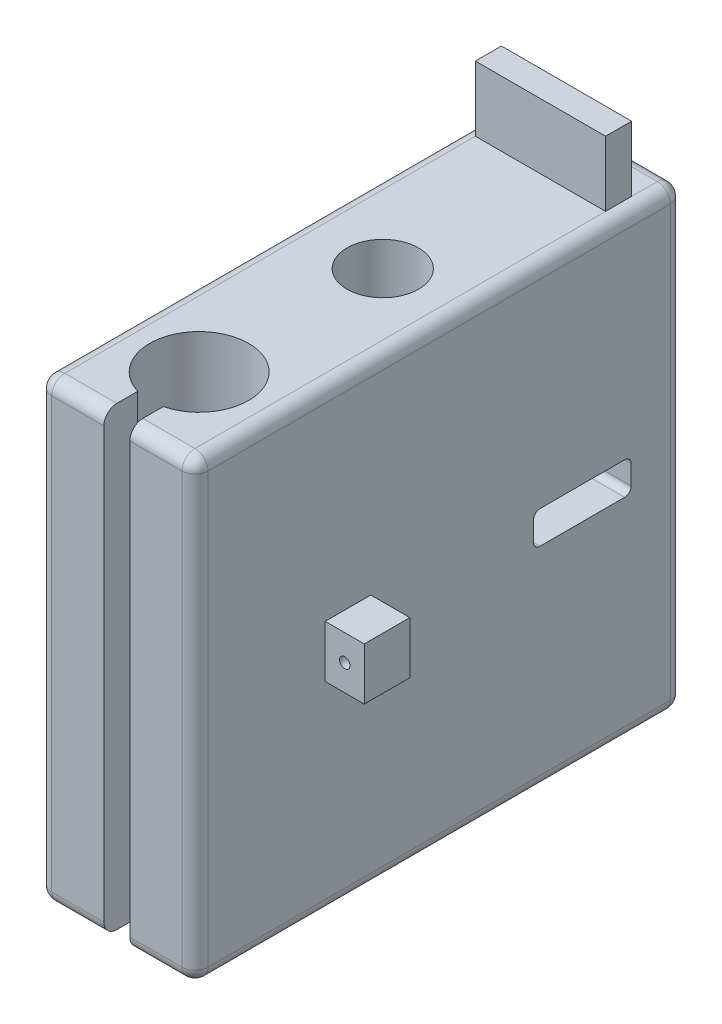
from build123d import *

# Parameters (mm, degrees)
RESSALTO_EXTRUS_O1_DEPTH                   = 12
RESSALTO_EXTRUS_O1_DEPTH_BACK              = 12
ESBO_O1_W                                  = 75
ESBO_O1_H                                  = 70
ESBO_O3_R                                  = 5.5
CORTE_EXTRUS_O1_DEPTH                      = 525.799189678
ESBO_O4_R                                  = 4.1
CORTE_EXTRUS_O2_DEPTH                      = 20
FILETE1_R                                  = 2
CORTE_EXTRUS_O3_DEPTH                      = 29
CORTE_EXTRUS_O4_DEPTH                      = 28
RESSALTO_EXTRUS_O2_DEPTH                   = 6
RESSALTO_EXTRUS_O2_DEPTH_BACK              = 30
ESBO_O7_W                                  = 7
ESBO_O7_H                                  = 8
BROCA_DE_ROSQUEAR_PARA_TARRAXA_DE_M2X0_4_D = 1.6
BROCA_DE_ROSQUEAR_PARA_TARRAXA_DE_M2_2_D   = 1.6
ESBO_O18_W                                 = 20
ESBO_O18_H                                 = 4
RESSALTO_EXTRUS_O3_DEPTH                   = 10


with BuildPart() as part:
    # Esboço1 → Ressalto-extrusão1 (new, two sides: drawn at the far end of the back side and taken through both)
    with BuildSketch(Plane(origin=(-220, 0, 0), x_dir=(0, 0, -1), z_dir=(1, 0, 0)).offset(-RESSALTO_EXTRUS_O1_DEPTH_BACK)):
        with Locations((-427.999935002, 213.253952806)):
            Rectangle(ESBO_O1_W, ESBO_O1_H)
    extrude(amount=RESSALTO_EXTRUS_O1_DEPTH + RESSALTO_EXTRUS_O1_DEPTH_BACK)

    # Esboço3 → Corte-extrusão1 (cut, through all)
    with BuildSketch(Plane(origin=(0, 248.253952806, 0), x_dir=(1, 0, 0), z_dir=(0, 1, 0))):
        with Locations((-219.508549322, -425.149935105)):
            Circle(ESBO_O3_R)
        with BuildLine():
            Line((-220, -465.499935002), (-218, -465.499935002))
            Line((-218, -465.499935002), (-218, -460.369179456))
            ThreePointArc((-218, -460.369179456), (-219.711945476, -445.401349285), (-222, -460.292000844))
            Line((-222, -460.292000844), (-222, -465.499935002))
            Line((-222, -465.499935002), (-220, -465.499935002))
        make_face()
    extrude(amount=-CORTE_EXTRUS_O1_DEPTH, mode=Mode.SUBTRACT)

    # Esboço4 → Corte-extrusão2 (cut)
    with BuildSketch(Plane(origin=(0, 0, 390.499935002), x_dir=(-1, 0, 0), z_dir=(0, 0, -1))):
        with Locations((219.858557552, 238.253952806)):
            Circle(ESBO_O4_R)
        with Locations((219.858557552, 188.253952806)):
            Circle(ESBO_O4_R)
    extrude(amount=-CORTE_EXTRUS_O2_DEPTH, mode=Mode.SUBTRACT)

    # Filete1
    filete1_edges = [part.edges().sort_by_distance(p)[0] for p in [
        (-227, 178.253952806, 465.499935002),
        (-213, 178.253952806, 465.499935002),
        (-213, 248.253952806, 465.499935002),
        (-227, 248.253952806, 465.499935002),
        (-208, 178.253952806, 427.999935002),
        (-208, 248.253952806, 427.999935002),
        (-208, 213.253952806, 465.499935002),
        (-232, 178.253952806, 427.999935002),
        (-232, 213.253952806, 465.499935002),
        (-232, 248.253952806, 427.999935002),
        (-220, 248.253952806, 390.499935002),
        (-220, 178.253952806, 390.499935002),
        (-208, 213.253952806, 390.499935002),
        (-232, 213.253952806, 390.499935002),
    ]]
    fillet(filete1_edges, radius=FILETE1_R)

    # Esboço5 → Corte-extrusão3 (cut)
    with BuildSketch(Plane(origin=(0, 0, 390.499935002), x_dir=(-1, 0, 0), z_dir=(0, 0, -1))):
        Polygon((213.958173206, 195.258702519), (225.958169176, 195.248868312), (225.987671797, 231.248856223), (213.987675826, 231.25869043), align=None)
    extrude(amount=-CORTE_EXTRUS_O3_DEPTH, mode=Mode.SUBTRACT)

    # Esboço6 → Corte-extrusão4 (cut)
    with BuildSketch(Plane.ZY.offset(232)):
        with BuildLine():
            Line((399.499935002, 215.753952806), (412.499935002, 215.753952806))
            ThreePointArc((412.499935002, 215.753952806), (413.207041783, 215.461059587), (413.499935002, 214.753952806))
            Line((413.499935002, 214.753952806), (413.499935002, 211.753952806))
            ThreePointArc((413.499935002, 211.753952806), (413.207041783, 211.046846025), (412.499935002, 210.753952806))
            Line((412.499935002, 210.753952806), (399.499935002, 210.753952806))
            ThreePointArc((399.499935002, 210.753952806), (398.792828221, 211.046846025), (398.499935002, 211.753952806))
            Line((398.499935002, 211.753952806), (398.499935002, 214.753952806))
            ThreePointArc((398.499935002, 214.753952806), (398.792828221, 215.461059587), (399.499935002, 215.753952806))
        make_face()
    extrude(amount=-CORTE_EXTRUS_O4_DEPTH, mode=Mode.SUBTRACT)

    # Esboço7 → Ressalto-extrusão2 (add, two sides: drawn at the far end of the back side and taken through both)
    with BuildSketch(Plane(origin=(-208, 0, 0), x_dir=(0, 0, -1), z_dir=(1, 0, 0)).offset(-RESSALTO_EXTRUS_O2_DEPTH_BACK)):
        with Locations((-441.999935002, 213.253952806)):
            Rectangle(ESBO_O7_W, ESBO_O7_H)
    extrude(amount=RESSALTO_EXTRUS_O2_DEPTH + RESSALTO_EXTRUS_O2_DEPTH_BACK)

    # Broca de rosquear para tarraxa de M2x0.4 (through all)
    with Locations(Plane.XY.offset(445.499935002)):
        with Locations((-205, 213.253952806)):
            Hole(BROCA_DE_ROSQUEAR_PARA_TARRAXA_DE_M2X0_4_D / 2)

    # Broca de rosquear para tarraxa de M2 2 (through all)
    with Locations(Plane.XY.offset(445.499935002)):
        with Locations((-235, 213.253952806)):
            Hole(BROCA_DE_ROSQUEAR_PARA_TARRAXA_DE_M2_2_D / 2)

    # Esboço18 → Ressalto-extrusão3 (add)
    with BuildSketch(Plane(origin=(0, 248.253952806, 0), x_dir=(1, 0, 0), z_dir=(0, 1, 0))):
        with Locations((-220, -398.434558943)):
            Rectangle(ESBO_O18_W, ESBO_O18_H)
    extrude(amount=RESSALTO_EXTRUS_O3_DEPTH)


solid = part.part
